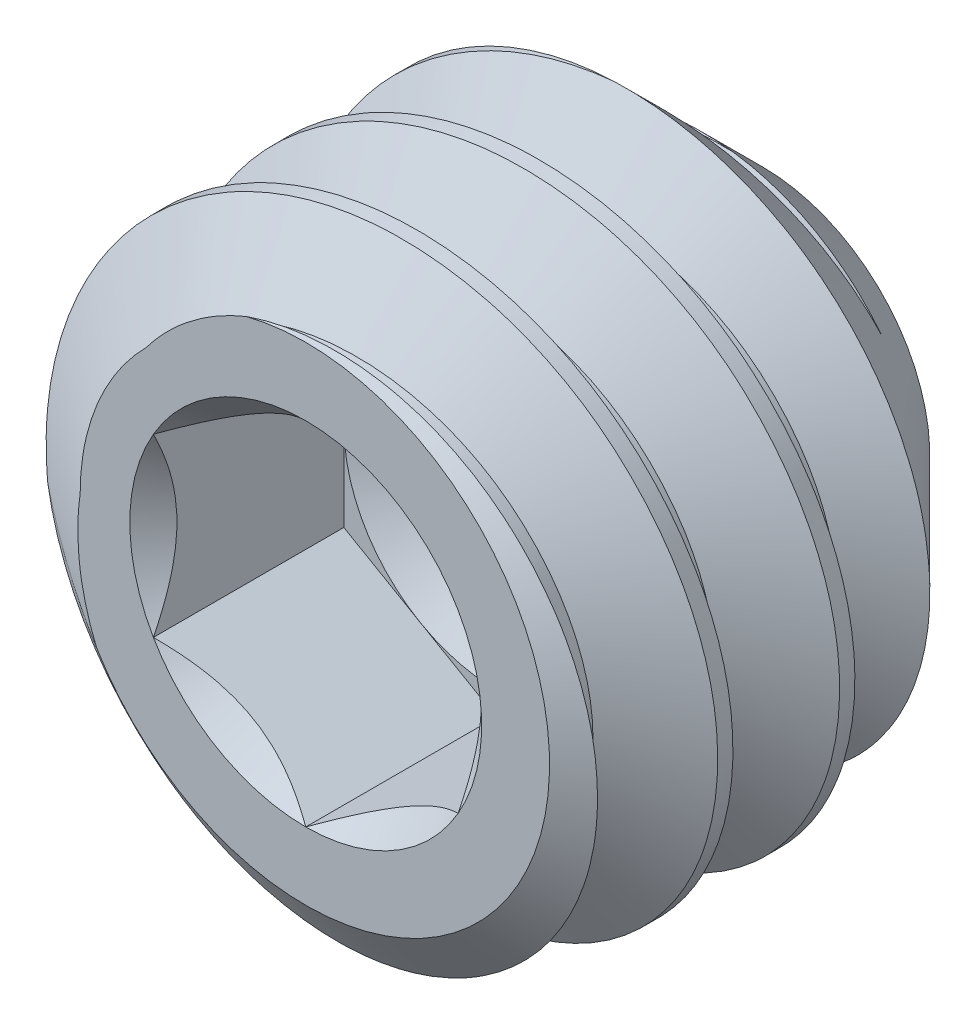
from build123d import *

# Parameters (mm, degrees)
CUT_SWEEP2_PITCH    = 1.27
CUT_EXTRUDE10_DEPTH = 1.984375


with BuildPart() as part:
    # Sketch22 → Revolve1 (revolve)
    with BuildSketch(Plane(origin=(0, 0, 0), x_dir=(0, 0, -1), z_dir=(1, 0, 0)), mode=Mode.PRIVATE) as revolve1_sk:
        Polygon((-1.858564779, 0), (-1.858564779, 2.54), (-1.413932992, 3.175), (1.468723798, 3.175), (2.903935221, 1.739788577), (1.858564779, 0), align=None)
    revolve(revolve1_sk.sketch.rotate(Axis((0, 0, -1.858564779), (0, 0, -1)), 180), axis=Axis((0, 0, -1.858564779), (0, 0, -1)))

    # Cut-Sweep2: the profile of Sketch28 profile screwed along a right-hand helix of 4.75 turns, 8 arcs to a turn; built about Z, then put on its axis
    cut_sweep2_z = Axis((0, 0, 0), (0, 0, 1))
    cut_sweep2_corners = [(3.1753, 0, 0.000173205), (3.1753, 0, -1.111423205), (2.350110803, 0, -0.635), (2.350110803, 0, -0.47625)]
    with BuildLine(mode=Mode.PRIVATE) as cut_sweep2_profile:
        Line(cut_sweep2_corners[0], cut_sweep2_corners[1])
        Line(cut_sweep2_corners[1], cut_sweep2_corners[2])
        Line(cut_sweep2_corners[2], cut_sweep2_corners[3])
        Line(cut_sweep2_corners[3], cut_sweep2_corners[0])
    cut_sweep2_cap = Face(cut_sweep2_profile.wire())
    cut_sweep2_turn_angles = [0, 22.5, 45, 67.5, 90, 112.5, 135, 157.5, 180, 202.5, 225, 247.5, 270, 292.5, 315, 337.5, 360]
    cut_sweep2_turn_weights = [1, 0.9238795325112867, 1, 0.9238795325112867, 1, 0.9238795325112867, 1, 0.9238795325112867, 1, 0.9238795325112867, 1, 0.9238795325112867, 1, 0.9238795325112867, 1, 0.9238795325112867, 1]
    cut_sweep2_turn_rails = [Edge.make_bspline([Vector(p[0], p[1], 0).rotate(cut_sweep2_z, cut_sweep2_turn_angles[k]) / cut_sweep2_turn_weights[k] + Vector(0, 0, p[2] + CUT_SWEEP2_PITCH * cut_sweep2_turn_angles[k] / 360) for k in range(17)], [0, 0, 0, 1, 1, 2, 2, 3, 3, 4, 4, 5, 5, 6, 6, 7, 7, 8, 8, 8], 2, cut_sweep2_turn_weights) for p in cut_sweep2_corners]
    cut_sweep2_turn_sides = [Face.make_surface_from_curves(cut_sweep2_turn_rails[p[0]], cut_sweep2_turn_rails[p[1]]) for p in [(0, 1), (1, 2), (2, 3), (3, 0)]]
    cut_sweep2_last_angles = [1440, 1462.5, 1485, 1507.5, 1530, 1552.5, 1575, 1597.5, 1620, 1642.5, 1665, 1687.5, 1710]
    cut_sweep2_last_weights = [1, 0.9238795325112867, 1, 0.9238795325112867, 1, 0.9238795325112867, 1, 0.9238795325112867, 1, 0.9238795325112867, 1, 0.9238795325112731, 1]
    cut_sweep2_last_rails = [Edge.make_bspline([Vector(p[0], p[1], 0).rotate(cut_sweep2_z, cut_sweep2_last_angles[k]) / cut_sweep2_last_weights[k] + Vector(0, 0, p[2] + CUT_SWEEP2_PITCH * cut_sweep2_last_angles[k] / 360) for k in range(13)], [0, 0, 0, 1, 1, 2, 2, 3, 3, 4, 4, 5, 5, 6, 6, 6], 2, cut_sweep2_last_weights) for p in cut_sweep2_corners]
    cut_sweep2_last_sides = [Face.make_surface_from_curves(cut_sweep2_last_rails[p[0]], cut_sweep2_last_rails[p[1]]) for p in [(0, 1), (1, 2), (2, 3), (3, 0)]]
    cut_sweep2 = Plane(origin=(0, 0, -2.903935221), x_dir=(0, 1, 0), z_dir=(0, 0, 1)) * Solid(Shell([*[p.moved(Location((0, 0, CUT_SWEEP2_PITCH * i))) for i in range(4) for p in cut_sweep2_turn_sides], *cut_sweep2_last_sides, cut_sweep2_cap, cut_sweep2_cap.rotate(cut_sweep2_z, 1710).moved(Location((0, 0, CUT_SWEEP2_PITCH * 1710 / 360)))]))
    add(cut_sweep2, mode=Mode.SUBTRACT)

    # Sketch23 → Cut-Extrude10 (cut)
    with BuildSketch(Plane.XY.offset(1.858564779)):
        Polygon((0, 1.833087105), (-1.5875, 0.916543552), (-1.5875, -0.916543552), (0, -1.833087105), (1.5875, -0.916543552), (1.5875, 0.916543552), align=None)
    extrude(amount=-CUT_EXTRUDE10_DEPTH, mode=Mode.SUBTRACT)

    # Cut-Extrude11 cone 1 section (through the dimple's axis) → Cut-Extrude11 (revolve, cut)
    with BuildSketch(Plane(origin=(0, 0, 1.858564779), x_dir=(0, -1, 0), z_dir=(1, 0, 0))):
        Polygon((0, 0), (1.833087105, 0), (0, 1.833087105), align=None)
    revolve(axis=Axis((0, 0, 1.858564779), (0, 0, -1)), mode=Mode.SUBTRACT)

    # Cut-Extrude12 cone 1 section (through the dimple's axis) → Cut-Extrude12 (revolve, cut)
    with BuildSketch(Plane(origin=(0, 0, -0.125810221), x_dir=(0, -1, 0), z_dir=(1, 0, 0))):
        Polygon((0, 0), (1.5875, 0), (0, 0.916543552), align=None)
    revolve(axis=Axis((0, 0, -0.125810221), (0, 0, -1)), mode=Mode.SUBTRACT)


solid = part.part
